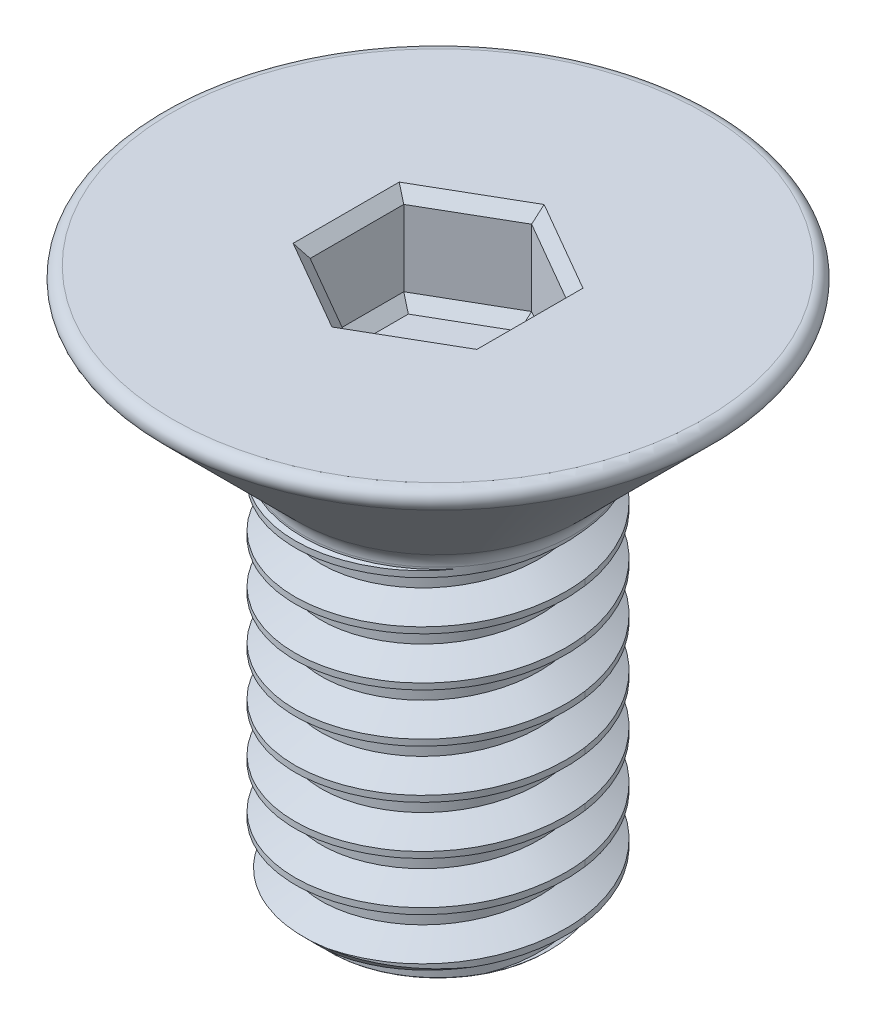
from build123d import *

# Parameters (mm, degrees)
SKETCH1_R           = 1.25
BOSS_EXTRUDE1_DEPTH = 3.45
THREAD1_PITCH       = 0.45
SKETCH5_R           = 1.25
BOSS_EXTRUDE2_DEPTH = 0.1
SKETCH6_R           = 1.25
BOSS_EXTRUDE3_DEPTH = 1.45
BOSS_EXTRUDE3_DRAFT = -45
FILLET1_R           = 0.2
FILLET2_R           = 0.1
CUT_EXTRUDE1_DEPTH  = 0.8
CHAMFER1_SIZE       = 0.1
CUT_EXTRUDE2_DEPTH  = 0.1
CUT_EXTRUDE2_DRAFT  = -45


with BuildPart() as part:
    # Sketch1 → Boss-Extrude1 (new body)
    with BuildSketch(Plane(origin=(0, 0, 0), x_dir=(1, 0, 0), z_dir=(0, 1, 0))):
        with Locations(Location((0, 0, 0), (0, 0, 90))):
            Circle(SKETCH1_R)
    extrude(amount=BOSS_EXTRUDE1_DEPTH)

    # Thread1: arcs per turn and ends read off the stored shape
    # Thread1: the profile of Thread Profile1 profile screwed along a right-hand helix through 12.111108 turns, 6 arcs to a turn; built about Z, then put on its axis
    thread1_z = Axis((0, 0, 0), (0, 0, 1))
    thread1_corners = [(1.2503, 0, -0.000173205), (1.2503, 0, 0.393923204), (1.006430356, 0, 0.253124999), (1.006430356, 0, 0.140624999)]
    with BuildLine(mode=Mode.PRIVATE) as thread1_profile:
        Line(thread1_corners[0], thread1_corners[1])
        Line(thread1_corners[1], thread1_corners[2])
        Line(thread1_corners[2], thread1_corners[3])
        Line(thread1_corners[3], thread1_corners[0])
    thread1_cap = Face(thread1_profile.wire())
    thread1_turn_angles = [0, 30, 60, 90, 120, 150, 180, 210, 240, 270, 300, 330, 360]
    thread1_turn_weights = [1, 0.8660254037844387, 1, 0.8660254037844387, 1, 0.8660254037844387, 1, 0.8660254037844387, 1, 0.8660254037844387, 1, 0.8660254037844387, 1]
    thread1_turn_rails = [Edge.make_bspline([Vector(p[0], p[1], 0).rotate(thread1_z, thread1_turn_angles[k]) / thread1_turn_weights[k] + Vector(0, 0, p[2] + THREAD1_PITCH * thread1_turn_angles[k] / 360) for k in range(13)], [0, 0, 0, 1, 1, 2, 2, 3, 3, 4, 4, 5, 5, 6, 6, 6], 2, thread1_turn_weights) for p in thread1_corners]
    thread1_turn_sides = [Face.make_surface_from_curves(thread1_turn_rails[p[0]], thread1_turn_rails[p[1]]) for p in [(0, 1), (1, 2), (2, 3), (3, 0)]]
    thread1_last_angles = [4320, 4339.9995, 4359.999]
    thread1_last_weights = [1, 0.9396956054389327, 1]
    thread1_last_rails = [Edge.make_bspline([Vector(p[0], p[1], 0).rotate(thread1_z, thread1_last_angles[k]) / thread1_last_weights[k] + Vector(0, 0, p[2] + THREAD1_PITCH * thread1_last_angles[k] / 360) for k in range(3)], [0, 0, 0, 1, 1, 1], 2, thread1_last_weights) for p in thread1_corners]
    thread1_last_sides = [Face.make_surface_from_curves(thread1_last_rails[p[0]], thread1_last_rails[p[1]]) for p in [(0, 1), (1, 2), (2, 3), (3, 0)]]
    thread1 = Plane(origin=(0, -1, 0), x_dir=(1, 0, 0), z_dir=(0, 1, 0)) * Solid(Shell([*[p.moved(Location((0, 0, THREAD1_PITCH * i))) for i in range(12) for p in thread1_turn_sides], *thread1_last_sides, thread1_cap, thread1_cap.rotate(thread1_z, 4359.999).moved(Location((0, 0, THREAD1_PITCH * 4359.999 / 360)))]))
    add(thread1, mode=Mode.SUBTRACT)

    # Sketch5 → Boss-Extrude2 (add)
    with BuildSketch(Plane(origin=(0, 3.45, 0), x_dir=(1, 0, 0), z_dir=(0, 1, 0))):
        with Locations(Location((0, 0, 0), (0, 0, 80.405931773))):
            Circle(SKETCH5_R)
    extrude(amount=BOSS_EXTRUDE2_DEPTH)


with BuildPart() as boss_extrude3_tool:
    # Sketch6 → Boss-Extrude3 (with draft: the straight prism first)
    with BuildSketch(Plane(origin=(0, 3.55, 0), x_dir=(1, 0, 0), z_dir=(0, 1, 0))):
        with Locations(Location((0, 0, 0), (0, 0, 80.405931773))):
            Circle(SKETCH6_R)
    extrude(amount=BOSS_EXTRUDE3_DEPTH)
    # Boss-Extrude3: the draft: its side faces are tilted about the plane it starts from
    boss_extrude3_sides = [boss_extrude3_tool.faces().sort_by_distance(p)[0] for p in [
        (-0.208333333, 4.275, 1.232516621),
    ]]
    draft(boss_extrude3_sides, Plane(origin=(0, 3.55, 0), x_dir=(1, 0, 0), z_dir=(0, 1, 0)), BOSS_EXTRUDE3_DRAFT)


with BuildPart() as part_1:
    add(part.part)

    # Boss-Extrude3: add boss_extrude3_tool
    add(boss_extrude3_tool.part)

    # Fillet1
    fillet1_edges = [part_1.edges().sort_by_distance(p)[0] for p in [
        (-0.208333333, 3.55, 1.232516621),
    ]]
    fillet(fillet1_edges, radius=FILLET1_R)

    # Fillet2
    fillet2_edges = [part_1.edges().sort_by_distance(p)[0] for p in [
        (-0.45, 5, 2.662235902),
    ]]
    fillet(fillet2_edges, radius=FILLET2_R)

    # Sketch7 → Cut-Revolve1 (revolve, cut)
    with BuildSketch(Plane.XY, mode=Mode.PRIVATE) as cut_revolve1_sk:
        Polygon((1.26, 0), (1.26, 0.26), (1, 0), align=None)
    revolve(cut_revolve1_sk.sketch.rotate(Axis((0, 0, 0), (0, 1, 0)), 5.375682681), axis=Axis((0, 0, 0), (0, 1, 0)), mode=Mode.SUBTRACT)

    # Sketch8 → Cut-Extrude1 (cut)
    with BuildSketch(Plane(origin=(0, 5, 0), x_dir=(1, 0, 0), z_dir=(0, 1, 0))):
        Polygon((0, 0.866025404), (-0.75, 0.433012702), (-0.75, -0.433012702), (0, -0.866025404), (0.75, -0.433012702), (0.75, 0.433012702), align=None)
    extrude(amount=-CUT_EXTRUDE1_DEPTH, mode=Mode.SUBTRACT)

    # Chamfer1
    chamfer1_edges = [part_1.edges().sort_by_distance(p)[0] for p in [
        (0.375, 5, -0.649519053),
        (-0.375, 5, -0.649519053),
        (-0.75, 5, 0),
        (-0.375, 5, 0.649519053),
        (0.375, 5, 0.649519053),
        (0.75, 5, 0),
    ]]
    chamfer(chamfer1_edges, length=CHAMFER1_SIZE)


with BuildPart() as cut_extrude2_tool:
    # Sketch9 → Cut-Extrude2 (with draft: the straight prism first)
    with BuildSketch(Plane(origin=(0, 4.2, 0), x_dir=(1, 0, 0), z_dir=(0, 1, 0))):
        Polygon((0, 0.866025404), (-0.75, 0.433012702), (-0.75, -0.433012702), (0, -0.866025404), (0.75, -0.433012702), (0.75, 0.433012702), align=None)
    extrude(amount=-CUT_EXTRUDE2_DEPTH)
    # Cut-Extrude2: the draft: its side faces are tilted about the plane it starts from
    cut_extrude2_sides = [cut_extrude2_tool.faces().sort_by_distance(p)[0] for p in [
        (-0.375, 4.15, -0.649519053),
        (-0.75, 4.15, 0),
        (-0.375, 4.15, 0.649519053),
        (0.375, 4.15, 0.649519053),
        (0.75, 4.15, 0),
        (0.375, 4.15, -0.649519053),
    ]]
    draft(cut_extrude2_sides, Plane(origin=(0, 4.2, 0), x_dir=(1, 0, 0), z_dir=(0, 1, 0)), CUT_EXTRUDE2_DRAFT)


with BuildPart() as part_2:
    add(part_1.part)

    # Cut-Extrude2: cut by cut_extrude2_tool
    add(cut_extrude2_tool.part, mode=Mode.SUBTRACT)


solid = part_2.part
